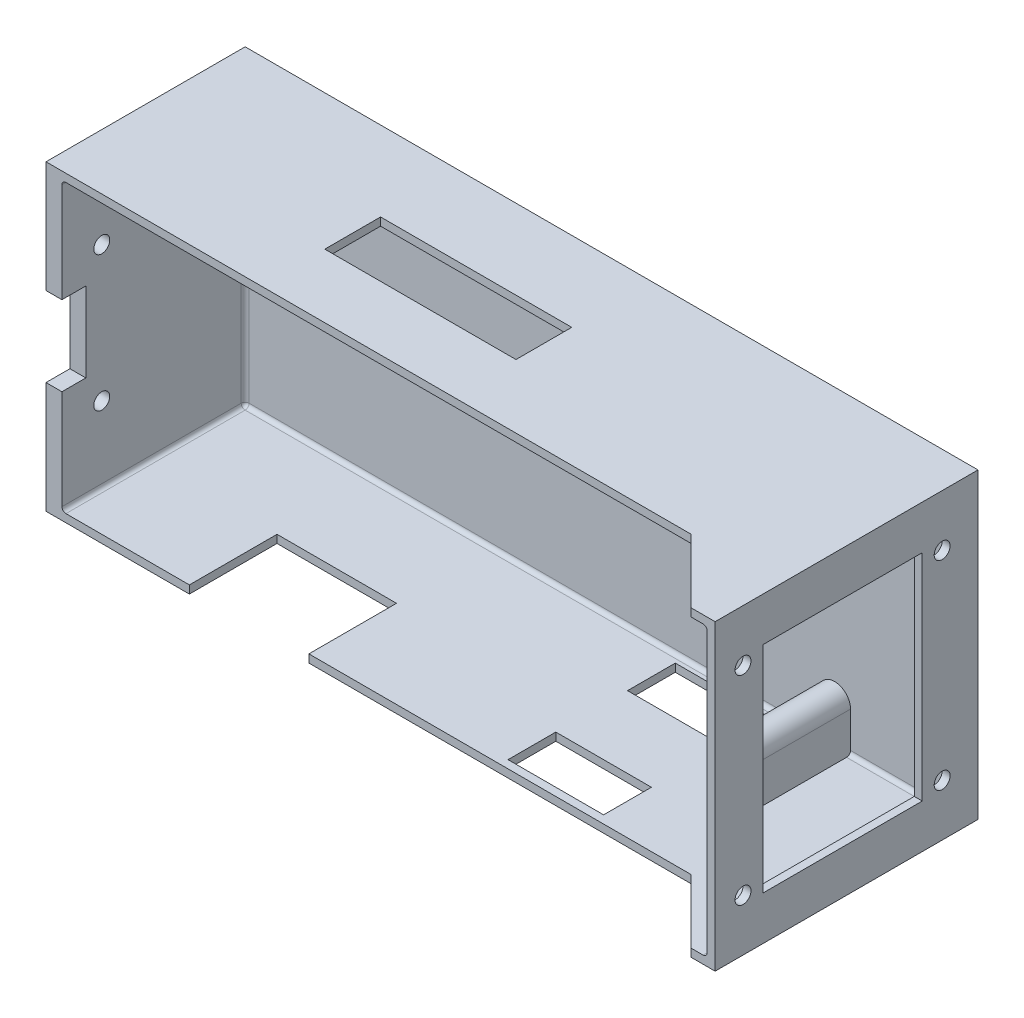
from build123d import *

# Parameters (mm, degrees)
SKETCH_1_W          = 90
SKETCH_1_H          = 38
EXTRUDE_1_DEPTH     = 2
EXTRUDE_2_DEPTH     = 23
CUT_EXTRUDE_1_REACH = 65.984
SKETCH_3_W          = 12
SKETCH_3_H          = 6
SKETCH_3_W_2        = 15
SKETCH_3_H_2        = 11
CUT_EXTRUDE_2_REACH = 65.984
SKETCH_4_W          = 24
SKETCH_4_H          = 7
SKETCH_7_W          = 1
SKETCH_7_H          = 38
EXTRUDE_3_DEPTH     = 8
CUT_EXTRUDE_3_REACH = 99.724
SKETCH_6_W          = 20
SKETCH_6_H          = 27
CUT_EXTRUDE_4_REACH = 99.724
SKETCH_8_R          = 1
CHAMFER_1_SIZE      = 10
FILLET_1_R          = 0.5
SKETCH_10_R         = 0.95
EXTRUDE_4_DEPTH     = 11
SKETCH_11_R         = 1
EXTRUDE_5_DEPTH     = 2
FILLET_2_R          = 0.5


with BuildPart() as part:
    # 草图1 → 凸台-拉伸1 (new body)
    with BuildSketch(Plane.XY):
        Rectangle(SKETCH_1_W, SKETCH_1_H)
    extrude(amount=EXTRUDE_1_DEPTH)

    # 草图2 → 凸台-拉伸2 (add)
    with BuildSketch(Plane.XY.offset(2)):
        Polygon((44, 18), (-44, 18), (-45, 18), (-45, 19), (45, 19), (45, -19), (-45, -19), (-45, -18), (-44, -18), (44, -18), align=None)
    extrude(amount=EXTRUDE_2_DEPTH)

    # 草图3 → 切除-拉伸1 (cut, up to next)
    with BuildSketch(Plane.XZ.offset(19), mode=Mode.PRIVATE) as cut_extrude_1_sk1:
        with Locations((16, 6)):
            Rectangle(SKETCH_3_W, SKETCH_3_H)
    cut_extrude_1_tool1 = extrude(cut_extrude_1_sk1.sketch, amount=-CUT_EXTRUDE_1_REACH, mode=Mode.PRIVATE) & part.part
    # 草图3 → 切除-拉伸1 (cut, up to next)
    with BuildSketch(Plane.XZ.offset(19), mode=Mode.PRIVATE) as cut_extrude_1_sk2:
        with Locations((16, 21)):
            Rectangle(SKETCH_3_W, SKETCH_3_H)
    cut_extrude_1_tool2 = extrude(cut_extrude_1_sk2.sketch, amount=-CUT_EXTRUDE_1_REACH, mode=Mode.PRIVATE) & part.part
    # 草图3 → 切除-拉伸1 (cut, up to next)
    with BuildSketch(Plane.XZ.offset(19), mode=Mode.PRIVATE) as cut_extrude_1_sk3:
        with Locations((-21.5, 19.5)):
            Rectangle(SKETCH_3_W_2, SKETCH_3_H_2)
    cut_extrude_1_tool3 = extrude(cut_extrude_1_sk3.sketch, amount=-CUT_EXTRUDE_1_REACH, mode=Mode.PRIVATE) & part.part
    add(cut_extrude_1_tool1.solids().sort_by_distance((16, -19, 6))[0], mode=Mode.SUBTRACT)
    add(cut_extrude_1_tool2.solids().sort_by_distance((16, -19, 21))[0], mode=Mode.SUBTRACT)
    add(cut_extrude_1_tool3.solids().sort_by_distance((-21.5, -19, 19.5))[0], mode=Mode.SUBTRACT)

    # 草图4 → 切除-拉伸2 (cut, up to next)
    with BuildSketch(Plane(origin=(0, 19, 0), x_dir=(1, 0, 0), z_dir=(0, 1, 0)), mode=Mode.PRIVATE) as cut_extrude_2_sk1:
        with Locations((-8, -13.5)):
            Rectangle(SKETCH_4_W, SKETCH_4_H)
    cut_extrude_2_tool1 = extrude(cut_extrude_2_sk1.sketch, amount=-CUT_EXTRUDE_2_REACH, mode=Mode.PRIVATE) & part.part
    add(cut_extrude_2_tool1.solids().sort_by_distance((-8, 19, 13.5))[0], mode=Mode.SUBTRACT)

    # 草图7 → 凸台-拉伸3 (add)
    with BuildSketch(Plane.XY.offset(25)):
        with Locations((44.5, 0)):
            Rectangle(SKETCH_7_W, SKETCH_7_H)
    extrude(amount=EXTRUDE_3_DEPTH)

    # 草图6 → 切除-拉伸3 (cut, up to next)
    with BuildSketch(Plane(origin=(45, 0, 0), x_dir=(0, 0, -1), z_dir=(1, 0, 0)), mode=Mode.PRIVATE) as cut_extrude_3_sk1:
        with Locations((-17, 0)):
            Rectangle(SKETCH_6_W, SKETCH_6_H)
    cut_extrude_3_tool1 = extrude(cut_extrude_3_sk1.sketch, amount=-CUT_EXTRUDE_3_REACH, mode=Mode.PRIVATE) & part.part
    add(cut_extrude_3_tool1.solids().sort_by_distance((45, 0, 17))[0], mode=Mode.SUBTRACT)

    # 草图8 → 切除-拉伸4 (cut, up to next)
    with BuildSketch(Plane(origin=(45, 0, 0), x_dir=(0, 0, -1), z_dir=(1, 0, 0)), mode=Mode.PRIVATE) as cut_extrude_4_sk1:
        with Locations((-29.5, 12.5)):
            Circle(SKETCH_8_R)
    cut_extrude_4_tool1 = extrude(cut_extrude_4_sk1.sketch, amount=-CUT_EXTRUDE_4_REACH, mode=Mode.PRIVATE) & part.part
    # 草图8 → 切除-拉伸4 (cut, up to next)
    with BuildSketch(Plane(origin=(45, 0, 0), x_dir=(0, 0, -1), z_dir=(1, 0, 0)), mode=Mode.PRIVATE) as cut_extrude_4_sk2:
        with Locations((-29.5, -12.5)):
            Circle(SKETCH_8_R)
    cut_extrude_4_tool2 = extrude(cut_extrude_4_sk2.sketch, amount=-CUT_EXTRUDE_4_REACH, mode=Mode.PRIVATE) & part.part
    # 草图8 → 切除-拉伸4 (cut, up to next)
    with BuildSketch(Plane(origin=(45, 0, 0), x_dir=(0, 0, -1), z_dir=(1, 0, 0)), mode=Mode.PRIVATE) as cut_extrude_4_sk3:
        with Locations((-4.5, -12.5)):
            Circle(SKETCH_8_R)
    cut_extrude_4_tool3 = extrude(cut_extrude_4_sk3.sketch, amount=-CUT_EXTRUDE_4_REACH, mode=Mode.PRIVATE) & part.part
    # 草图8 → 切除-拉伸4 (cut, up to next)
    with BuildSketch(Plane(origin=(45, 0, 0), x_dir=(0, 0, -1), z_dir=(1, 0, 0)), mode=Mode.PRIVATE) as cut_extrude_4_sk4:
        with Locations((-4.5, 12.5)):
            Circle(SKETCH_8_R)
    cut_extrude_4_tool4 = extrude(cut_extrude_4_sk4.sketch, amount=-CUT_EXTRUDE_4_REACH, mode=Mode.PRIVATE) & part.part
    add(cut_extrude_4_tool1.solids().sort_by_distance((45, 12.5, 29.5))[0], mode=Mode.SUBTRACT)
    add(cut_extrude_4_tool2.solids().sort_by_distance((45, -12.5, 29.5))[0], mode=Mode.SUBTRACT)
    add(cut_extrude_4_tool3.solids().sort_by_distance((45, -12.5, 4.5))[0], mode=Mode.SUBTRACT)
    add(cut_extrude_4_tool4.solids().sort_by_distance((45, 12.5, 4.5))[0], mode=Mode.SUBTRACT)

    # 倒角1
    # the kernel refuses this chamfer: 10 mm, written as the material it adds along each edge
    with BuildSketch(Plane(origin=(44, 19, 25), x_dir=(-0.9996219169112968, 0, -0.027495876610586317), z_dir=(0, -1, 0))) as chamfer_1_piece_1_section:
        Polygon((CHAMFER_1_SIZE * 0.999621916911, -CHAMFER_1_SIZE * 0.0274958766106), (-CHAMFER_1_SIZE * 0.0274958766106, -CHAMFER_1_SIZE * 0.999621916911), (0, 0), align=None)
    chamfer_1_piece_1 = extrude(amount=1, mode=Mode.PRIVATE)
    chamfer_1_piece_1 = split(chamfer_1_piece_1, bisect_by=Plane(origin=(39.481481481, 18.5, 33), z_dir=(0, 0, -1)), keep=Keep.TOP, mode=Mode.PRIVATE)
    add(chamfer_1_piece_1)
    with BuildSketch(Plane(origin=(44, -18, 25), x_dir=(0.027495876610586317, 0, 0.9996219169112968), z_dir=(0, -1, 0))) as chamfer_1_piece_2_section:
        Polygon((CHAMFER_1_SIZE * 0.999621916911, CHAMFER_1_SIZE * 0.0274958766106), (-CHAMFER_1_SIZE * 0.0274958766106, CHAMFER_1_SIZE * 0.999621916911), (0, 0), align=None)
    chamfer_1_piece_2 = extrude(amount=1, mode=Mode.PRIVATE)
    chamfer_1_piece_2 = split(chamfer_1_piece_2, bisect_by=Plane(origin=(41.2, -18.5, 33), z_dir=(0, 0, -1)), keep=Keep.TOP, mode=Mode.PRIVATE)
    add(chamfer_1_piece_2)

    # 圆角1
    fillet_1_edges = [part.edges().sort_by_distance(p)[0] for p in [
        (-0.5, 18, 2),
        (44, 0, 2),
        (44, 18, 17.5),
        (-0.5, -18, 2),
        (44, -18, 17.5),
    ]]
    fillet(fillet_1_edges, radius=FILLET_1_R)

    # 草图10 → 凸台-拉伸4 (add)
    # profile 1 of 2: a face of its own
    with BuildSketch(Plane.XY.offset(2)):
        with BuildLine():
            Line((31, 13), (31, 18))
            Line((31, 18), (27, 18))
            Line((27, 18), (27, 13))
            ThreePointArc((27, 13), (29, 11), (31, 13))
        make_face()
        with Locations((29, 13)):
            Circle(SKETCH_10_R, mode=Mode.SUBTRACT)
    # profile 2 of 2: a face of its own
    with BuildSketch(Plane.XY.offset(2)):
        with BuildLine():
            Line((31, -13), (31, -18))
            Line((31, -18), (27, -18))
            Line((27, -18), (27, -13))
            ThreePointArc((27, -13), (29, -11), (31, -13))
        make_face()
        with Locations(Location((29, -13, 0), (0, 0, 180))):
            Circle(SKETCH_10_R, mode=Mode.SUBTRACT)
    extrude(amount=EXTRUDE_4_DEPTH)

    # 草图11 → 凸台-拉伸5 (add)
    with BuildSketch(Plane.ZY.offset(45)):
        Polygon((0, 19), (25, 19), (25, 5), (22, 5), (22, -5), (25, -5), (25, -19), (0, -19), align=None)
        with Locations(Location((20, 8.5, 0), (0, 0, 270))):
            Circle(SKETCH_11_R, mode=Mode.SUBTRACT)
        with Locations(Location((20, -8.5, 0), (0, 0, 270))):
            Circle(SKETCH_11_R, mode=Mode.SUBTRACT)
    extrude(amount=EXTRUDE_5_DEPTH)

    # 圆角2
    fillet_2_edges = [part.edges().sort_by_distance(p)[0] for p in [
        (-45, 18, 13.75),
        (-45, 0, 2),
        (-45, -17.853553391, 2.146446609),
        (-45, 17.853553391, 2.146446609),
        (-45, -18, 13.75),
    ]]
    fillet(fillet_2_edges, radius=FILLET_2_R)


solid = part.part
